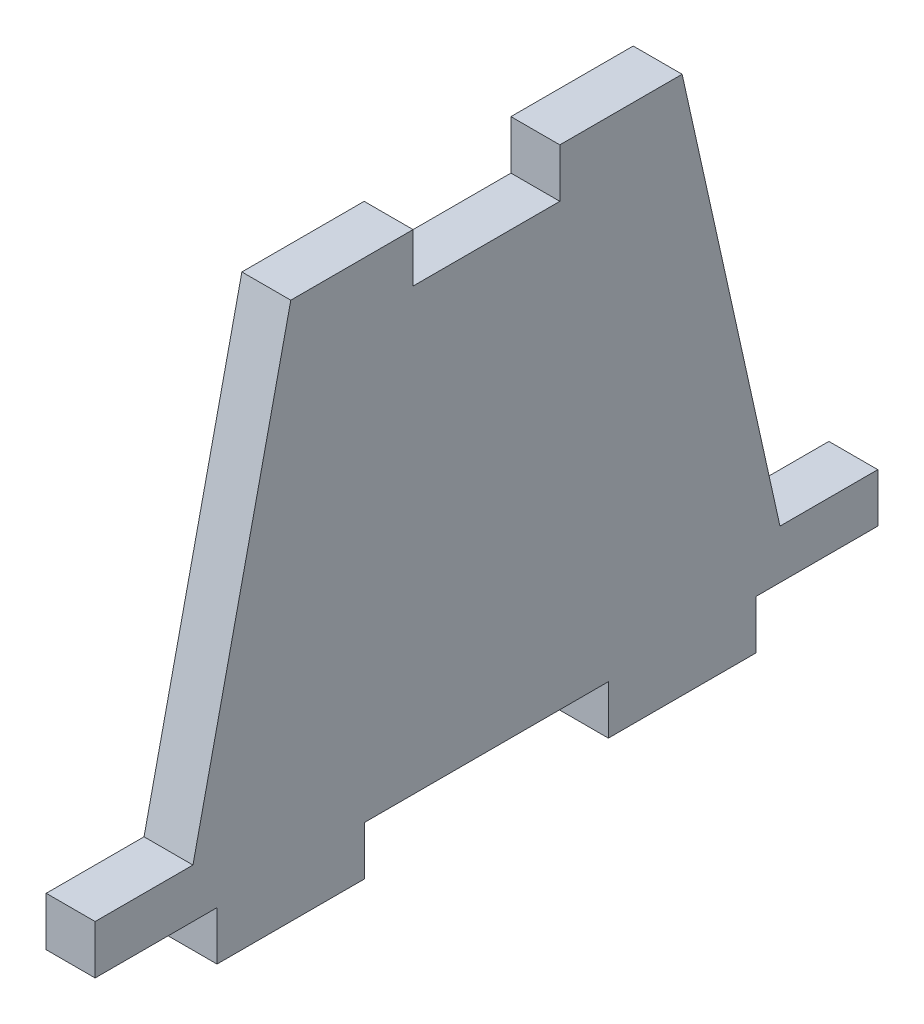
from build123d import *

# Parameters (mm, degrees)
BOSS_EXTRUDE1_DEPTH = 1.5875


with BuildPart() as part:
    # Sketch1 → Boss-Extrude1 (new, symmetric)
    with BuildSketch(Plane(origin=(0, 0, 0), x_dir=(0, 0, -1), z_dir=(1, 0, 0))):
        Polygon((-25.4, 0), (-17.4879, 0), (-17.4879, -3.175), (-7.9121, -3.175), (-7.9121, 0), (7.9121, 0), (7.9121, -3.175), (17.4879, -3.175), (17.4879, 0), (25.4, 0), (25.4, 3.175), (19.05, 3.175), (12.7, 31.75), (4.7625, 31.75), (4.7625, 28.575), (-4.7625, 28.575), (-4.7625, 31.75), (-12.7, 31.75), (-19.05, 3.175), (-25.4, 3.175), align=None)
    extrude(amount=BOSS_EXTRUDE1_DEPTH, both=True)


solid = part.part
